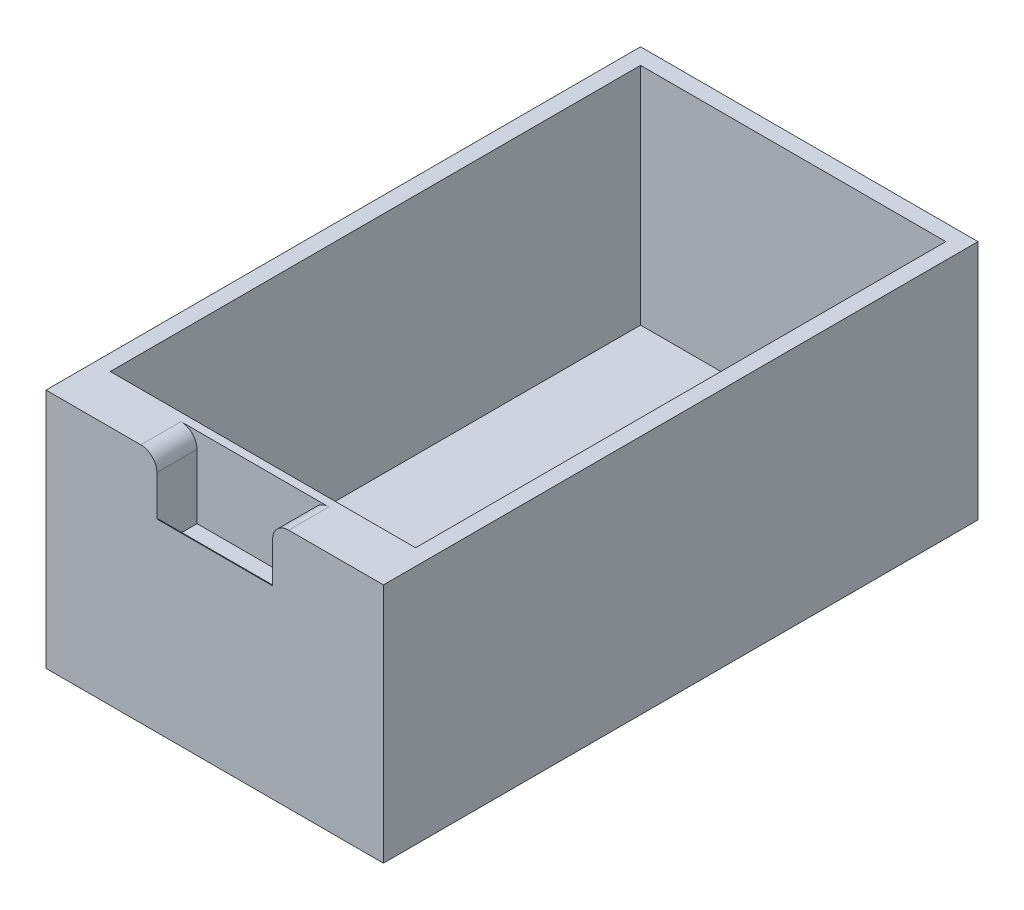
from build123d import *

# Parameters (mm, degrees)
ESQUISSE1_W             = 210
ESQUISSE1_H             = 150
BOSS_EXTRU_1_DEPTH      = 370
ESQUISSE2_W             = 190
ESQUISSE2_H             = 330
ENL_V_MAT_EXTRU_1_DEPTH = 140
ESQUISSE6_W             = 72
ESQUISSE6_H             = 25
ENL_V_MAT_EXTRU_4_DEPTH = 35
ESQUISSE7_W             = 72
ESQUISSE7_H             = 20
ENL_V_MAT_EXTRU_5_DEPTH = 15
CONG_3_R                = 10
CONG_4_R                = 10
CONG_5_R                = 10


with BuildPart() as part:
    # Esquisse1 → Boss.-Extru.1 (new body)
    with BuildSketch(Plane.XY):
        with Locations((-54.477344992, -11.176470588)):
            Rectangle(ESQUISSE1_W, ESQUISSE1_H)
    extrude(amount=-BOSS_EXTRU_1_DEPTH)

    # Esquisse2 → Enlèv. mat.-Extru.1 (cut)
    with BuildSketch(Plane(origin=(0, 63.823529412, 0), x_dir=(1, 0, 0), z_dir=(0, 1, 0))):
        with Locations((-54.477344992, 195)):
            Rectangle(ESQUISSE2_W, ESQUISSE2_H)
    extrude(amount=-ENL_V_MAT_EXTRU_1_DEPTH, mode=Mode.SUBTRACT)

    # Esquisse6 → Enlèv. mat.-Extru.4 (cut)
    with BuildSketch(Plane(origin=(0, 63.823529412, 0), x_dir=(1, 0, 0), z_dir=(0, 1, 0))):
        with Locations((-54.477344992, 12.5)):
            Rectangle(ESQUISSE6_W, ESQUISSE6_H)
    extrude(amount=-ENL_V_MAT_EXTRU_4_DEPTH, mode=Mode.SUBTRACT)

    # Esquisse7 → Enlèv. mat.-Extru.5 (cut)
    with BuildSketch(Plane(origin=(0, 28.823529412, 0), x_dir=(1, 0, 0), z_dir=(0, 1, 0))):
        with Locations((-54.477344992, 15)):
            Rectangle(ESQUISSE7_W, ESQUISSE7_H)
    extrude(amount=-ENL_V_MAT_EXTRU_5_DEPTH, mode=Mode.SUBTRACT)

    # Congé3
    cong_3_edges = [part.edges().sort_by_distance(p)[0] for p in [
        (-90.477344992, 63.823529412, -12.5),
    ]]
    fillet(cong_3_edges, radius=CONG_3_R)

    # Congé4
    cong_4_edges = [part.edges().sort_by_distance(p)[0] for p in [
        (-18.477344992, 63.823529412, -12.5),
    ]]
    fillet(cong_4_edges, radius=CONG_4_R)

    # Congé5
    # the kernel refuses this fillet: 10 mm, written as the material it takes off along each edge
    with BuildSketch(Plane(origin=(-18.477344992, 28.823529412, -5), x_dir=(0, 0, 1), z_dir=(-1, 0, 0))) as cong_5_piece_1:
        with BuildLine():
            CenterArc((10, -8.660254038), CONG_5_R, 120, 60)
            Line((0, -8.660254038), (-0.2, -8.660254038))
            Line((-0.2, -8.660254038), (-0.2, 0))
            Line((-0.2, 0), (0, 0.2))
            ThreePointArc((0, 0.2), (2.5, 0.2), (4.9, 0.173205081))
            Line((4.9, 0.173205081), (5, 0))
        make_face()
    extrude(amount=72, mode=Mode.SUBTRACT)


solid = part.part
